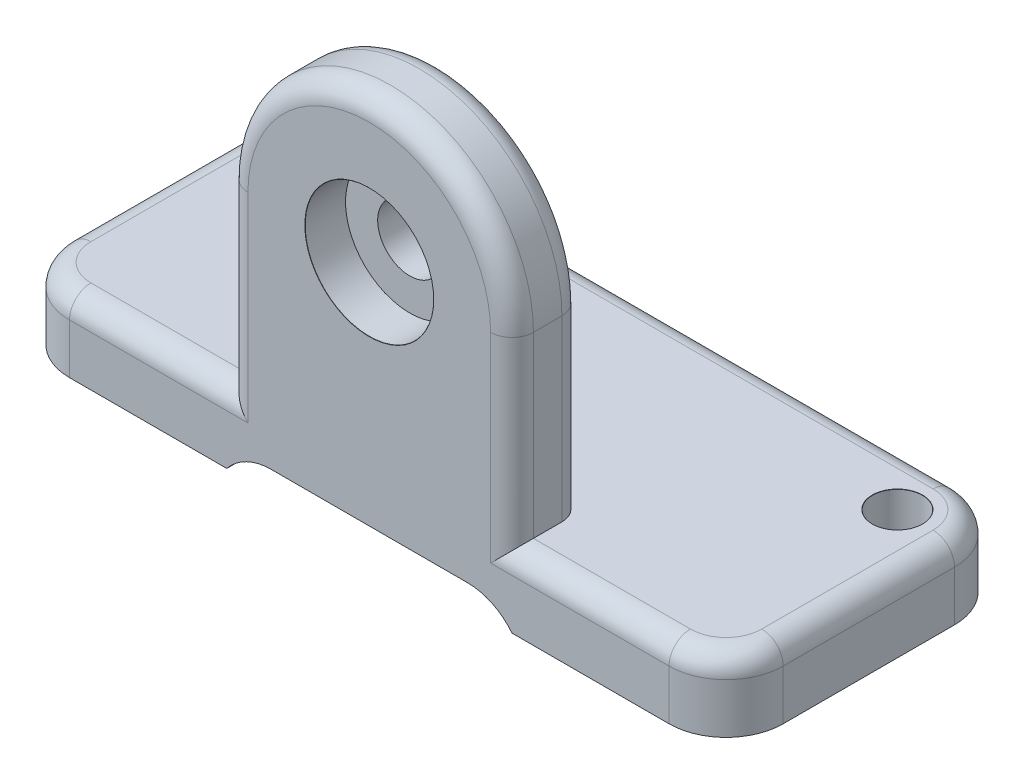
from build123d import *

# Parameters (mm, degrees)
ESBO_O1_W                            = 100
ESBO_O1_H                            = 40
RESSALTO_EXTRUS_O1_DEPTH             = 10
RESSALTO_EXTRUS_O2_DEPTH             = 10
ESBO_O3_W                            = 39.962527671
ESBO_O3_H                            = 3
CORTE_EXTRUS_O1_DEPTH                = 121.933866224
FILETE1_R                            = 8
FURO_DE_DI_METRO_7_0_7_1_D           = 7
FURO_DE_DI_METRO_7_0_7_1_CSINK_D     = 7.05
FURO_DE_DI_METRO_7_0_7_1_CSINK_ANGLE = 90
FURO_DE_DI_METRO_7_0_7_3_D           = 7
FURO_DE_DI_METRO_7_0_7_3_CSINK_D     = 7.05
FURO_DE_DI_METRO_7_0_7_3_CSINK_ANGLE = 90
FILETE3_R                            = 3


with BuildPart() as part:
    # Esboço1 → Ressalto-extrusão1 (new body)
    with BuildSketch(Plane(origin=(0, 0, 0), x_dir=(1, 0, 0), z_dir=(0, 1, 0))):
        with Locations((50, 20)):
            Rectangle(ESBO_O1_W, ESBO_O1_H)
    extrude(amount=RESSALTO_EXTRUS_O1_DEPTH)

    # Esboço2 → Ressalto-extrusão2 (add)
    with BuildSketch(Plane.XY):
        with BuildLine():
            Line((30, 0), (30, 35))
            ThreePointArc((30, 35), (50, 55), (70, 35))
            Line((70, 35), (70, 0))
            Line((70, 0), (30, 0))
        make_face()
    extrude(amount=-RESSALTO_EXTRUS_O2_DEPTH)

    # Esboço3 → Corte-extrusão1 (cut, through all)
    with BuildSketch(Plane.XY):
        with Locations((50.018736164, 1.5)):
            Rectangle(ESBO_O3_W, ESBO_O3_H)
    extrude(amount=-CORTE_EXTRUS_O1_DEPTH, mode=Mode.SUBTRACT)

    # Filete1
    # the kernel refuses this fillet: 8 mm, written as the material it adds along each edge
    with BuildSketch(Plane(origin=(70, 3, 0), x_dir=(-1, 0, 0), z_dir=(0, 0, -1))) as filete1_piece_1:
        with BuildLine():
            CenterArc((6.244997998, -8), FILETE1_R, 90, 51.317812547)
            Line((0, -3), (0, 0))
            Line((0, 0), (6.244997998, 0))
        make_face()
    extrude(amount=40)
    with BuildSketch(Plane(origin=(30.037472329, 3, 0), x_dir=(0, -1, 0), z_dir=(0, 0, -1))) as filete1_piece_2:
        with BuildLine():
            CenterArc((8, -6.244997998), FILETE1_R, 128.682187453, 51.317812547)
            Line((0, -6.244997998), (0, 0))
            Line((0, 0), (3, 0))
        make_face()
    extrude(amount=40)
    # the kernel refuses this fillet: 8 mm, written as the material it takes off along each edge
    with BuildSketch(Plane(origin=(100, -20, 0), x_dir=(-1, 0, 0), z_dir=(0, 1, 0)), Plane(origin=(100, -20, -40), x_dir=(0, 0, 1), z_dir=(0, 1, 0))) as filete1_2_piece_1:
        with BuildLine():
            CenterArc((FILETE1_R, -FILETE1_R), FILETE1_R, 90, 90)
            Line((0, -FILETE1_R), (0, 0))
            Line((0, 0), (FILETE1_R, 0))
        make_face()
    extrude(amount=50, mode=Mode.SUBTRACT)
    with BuildSketch(Plane(origin=(0, -20, -40), x_dir=(0, 0, 1), z_dir=(0, 1, 0)), Plane(origin=(0, -20, 0), x_dir=(1, 0, 0), z_dir=(0, 1, 0))) as filete1_2_piece_2:
        with BuildLine():
            CenterArc((FILETE1_R, FILETE1_R), FILETE1_R, 180, 90)
            Line((0, FILETE1_R), (0, 0))
            Line((0, 0), (FILETE1_R, 0))
        make_face()
    extrude(amount=50, mode=Mode.SUBTRACT)

    # Furo de diâmetro Ø7.0 (7)1 (through all)
    with Locations(Plane(origin=(0, 10, 0), x_dir=(1, 0, 0), z_dir=(0, 1, 0))):
        with Locations((8, 32)):
            CounterSinkHole(FURO_DE_DI_METRO_7_0_7_1_D / 2, FURO_DE_DI_METRO_7_0_7_1_CSINK_D / 2, counter_sink_angle=FURO_DE_DI_METRO_7_0_7_1_CSINK_ANGLE)

    # Furo de diâmetro Ø7.0 (7)3 (through all)
    with Locations(Plane(origin=(0, 10, 0), x_dir=(1, 0, 0), z_dir=(0, 1, 0))):
        with Locations((92, 32)):
            CounterSinkHole(FURO_DE_DI_METRO_7_0_7_3_D / 2, FURO_DE_DI_METRO_7_0_7_3_CSINK_D / 2, counter_sink_angle=FURO_DE_DI_METRO_7_0_7_3_CSINK_ANGLE)

    # Esboço16 → Rebaixo para parafuso de cabeça sextavada de M81 (revolve, cut)
    with BuildSketch(Plane(origin=(50, 35, 0), x_dir=(0, -1, 0), z_dir=(1, 0, 0))):
        Polygon((0, 0), (0, 40), (4.5, 40), (4.5, 5.68), (9.005, 5.68), (9.005, 0.025), (9.03, 0), align=None)
    revolve(axis=Axis((50, 35, 6.35), (0, 0, -1)), mode=Mode.SUBTRACT)

    # Filete3
    filete3_edges = [part.edges().sort_by_distance(p)[0] for p in [
        (81, 10, 0),
        (30, 22.5, -10),
        (70, 22.5, -10),
        (30, 22.5, 0),
        (70, 22.5, 0),
        (50, 55, 0),
        (50, 55, -10),
        (100, 10, -20),
        (19, 10, 0),
        (50, 10, -40),
        (0, 10, -20),
        (2.343145751, 10, -2.343145751),
        (2.343145751, 10, -37.656854249),
        (97.656854249, 10, -37.656854249),
        (97.656854249, 10, -2.343145751),
    ]]
    fillet(filete3_edges, radius=FILETE3_R)


solid = part.part
